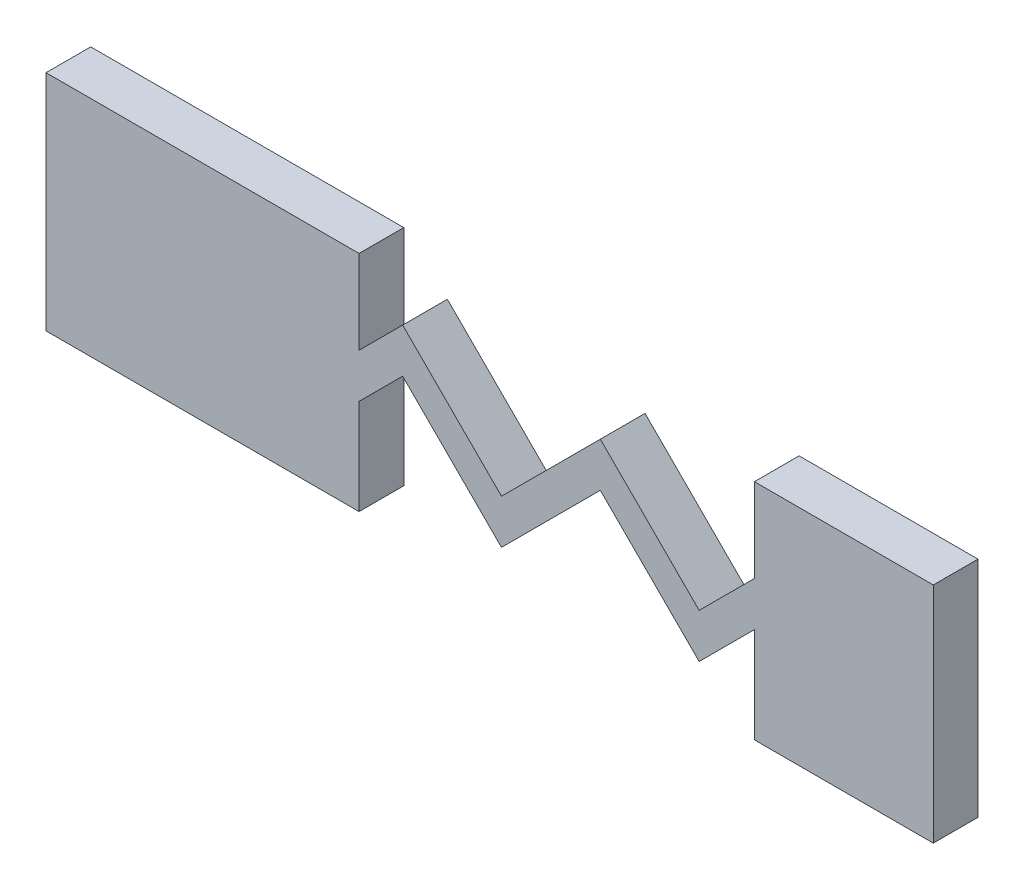
from build123d import *

# Parameters (mm, degrees)
BOSS_EXTRUDE1_DEPTH = 2


with BuildPart() as part:
    # Sketch1 → Boss-Extrude1 (new body)
    with BuildSketch(Plane.XY):
        Polygon((15.95, 8.2), (14, 6.25), (14, 10), (0, 10), (0, 0), (14, 0), (14, 4.270101013), (15.95, 6.220101013), (20.370101013, 1.8), (24.790202025, 6.220101013), (29.210303038, 1.8), (31.680404051, 4.270101013), (31.680404051, 0), (39.680404051, 0), (39.680404051, 10), (31.680404051, 10), (31.680404051, 6.25), (29.210303038, 3.779898987), (24.790202025, 8.2), (20.370101013, 3.779898987), align=None)
    extrude(amount=BOSS_EXTRUDE1_DEPTH)


solid = part.part
